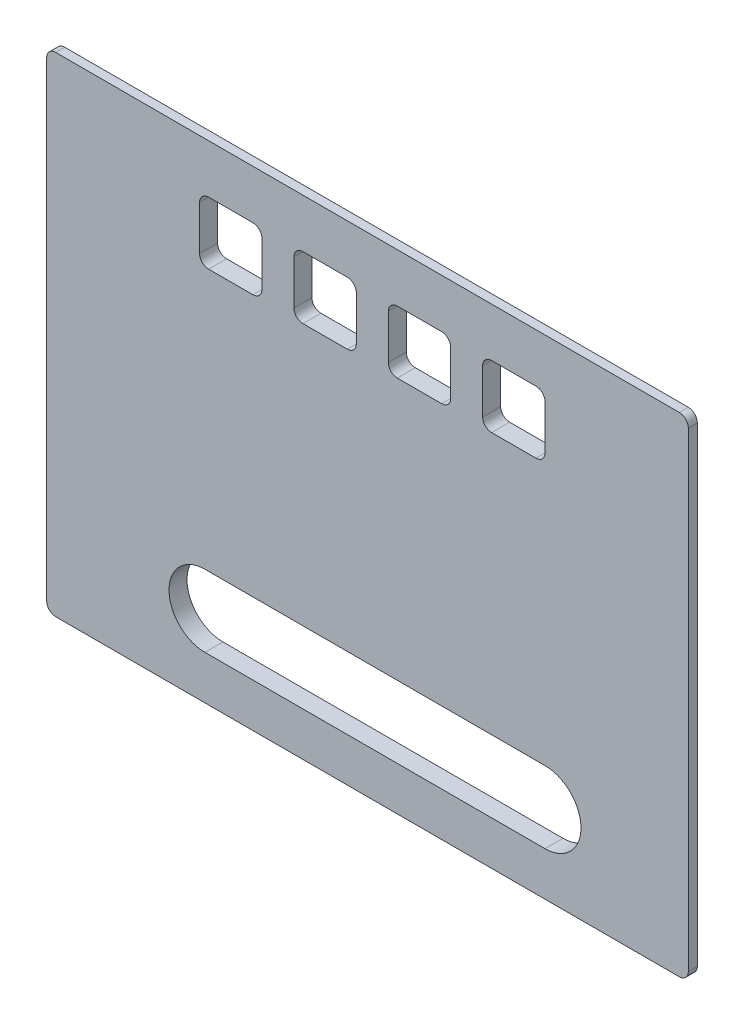
from build123d import *

# Parameters (mm, degrees)
SKETCH_1_W                                = 101
SKETCH_1_H                                = 74
EXTRUDE_1_DEPTH                           = 3
EXTRUDE_START                             = 1.5
SKETCH_2_W                                = 107
SKETCH_2_H                                = 80
EXTRUDE_2_DEPTH                           = 1.5
SKETCH_3_W                                = 10.4
SKETCH_3_H                                = 10.4
CUT_EXTRUDE_1_DEPTH                       = 5
SKETCH_4_W                                = 101
SKETCH_4_H                                = 1.5
TOP_REAR_INNER_EXTENSION_1P5MM_DEPTH      = 3
TOP_REAR_OUTER_SKIN_EXTENSION_1P5MM_START = 1.5
SKETCH_5_W                                = 107
SKETCH_5_H                                = 1.5
TOP_REAR_OUTER_SKIN_EXTENSION_1P5MM_DEPTH = 1.5
TOOL_D3_R1P5_BUTTON_CORNERS_R             = 1.5
TOOL_D3_R1P5_TOP_OUTER_CONTOUR_R          = 1.5


with BuildPart() as part:
    # Эскиз1 → Бобышка-Вытянуть1 (new body)
    with BuildSketch(Plane.XY):
        with Locations((53.5, 40)):
            Rectangle(SKETCH_1_W, SKETCH_1_H)
    extrude(amount=EXTRUDE_1_DEPTH)

    # Эскиз2 → Бобышка-Вытянуть2 (add)
    with BuildSketch(Plane.XY.offset(EXTRUDE_START)):
        with Locations((53.5, 40)):
            Rectangle(SKETCH_2_W, SKETCH_2_H)
    extrude(amount=EXTRUDE_2_DEPTH)

    # Эскиз3 → Вырез-Вытянуть1 (cut)
    with BuildSketch(Plane.XY.offset(3)):
        with Locations((30.7, 68.15)):
            Rectangle(SKETCH_3_W, SKETCH_3_H)
        with Locations((46.433, 68.15)):
            Rectangle(SKETCH_3_W, SKETCH_3_H)
        with Locations((62.167, 68.15)):
            Rectangle(SKETCH_3_W, SKETCH_3_H)
        with Locations((77.9, 68.15)):
            Rectangle(SKETCH_3_W, SKETCH_3_H)
        with BuildLine():
            Line((26.4, 19.3), (83.1, 19.3))
            ThreePointArc((83.1, 19.3), (89.1, 13.3), (83.1, 7.3))
            Line((83.1, 7.3), (26.4, 7.3))
            ThreePointArc((26.4, 7.3), (20.4, 13.3), (26.4, 19.3))
        make_face()
    extrude(amount=-CUT_EXTRUDE_1_DEPTH, mode=Mode.SUBTRACT)

    # Эскиз4 → top_rear_inner_extension_1p5mm (add)
    with BuildSketch(Plane.XY):
        with Locations((53.5, 77.75)):
            Rectangle(SKETCH_4_W, SKETCH_4_H)
    extrude(amount=TOP_REAR_INNER_EXTENSION_1P5MM_DEPTH)

    # Эскиз5 → top_rear_outer_skin_extension_1p5mm (add)
    with BuildSketch(Plane.XY.offset(TOP_REAR_OUTER_SKIN_EXTENSION_1P5MM_START)):
        with Locations((53.5, 80.75)):
            Rectangle(SKETCH_5_W, SKETCH_5_H)
    extrude(amount=TOP_REAR_OUTER_SKIN_EXTENSION_1P5MM_DEPTH)

    # tool_D3_R1p5_button_corners
    tool_d3_r1p5_button_corners_edges = [part.edges().sort_by_distance(p)[0] for p in [
        (72.7, 73.35, 1.5),
        (83.1, 73.35, 1.5),
        (83.1, 62.95, 1.5),
        (72.7, 62.95, 1.5),
        (56.967, 73.35, 1.5),
        (67.367, 73.35, 1.5),
        (67.367, 62.95, 1.5),
        (56.967, 62.95, 1.5),
        (41.233, 73.35, 1.5),
        (51.633, 73.35, 1.5),
        (51.633, 62.95, 1.5),
        (41.233, 62.95, 1.5),
        (25.5, 62.95, 1.5),
        (35.9, 62.95, 1.5),
        (35.9, 73.35, 1.5),
        (25.5, 73.35, 1.5),
    ]]
    fillet(tool_d3_r1p5_button_corners_edges, radius=TOOL_D3_R1P5_BUTTON_CORNERS_R)

    # tool_D3_R1p5_top_outer_contour
    tool_d3_r1p5_top_outer_contour_edges = [part.edges().sort_by_distance(p)[0] for p in [
        (0, 81.5, 2.25),
        (107, 81.5, 2.25),
        (107, 0, 2.25),
        (0, 0, 2.25),
    ]]
    fillet(tool_d3_r1p5_top_outer_contour_edges, radius=TOOL_D3_R1P5_TOP_OUTER_CONTOUR_R)


solid = part.part
